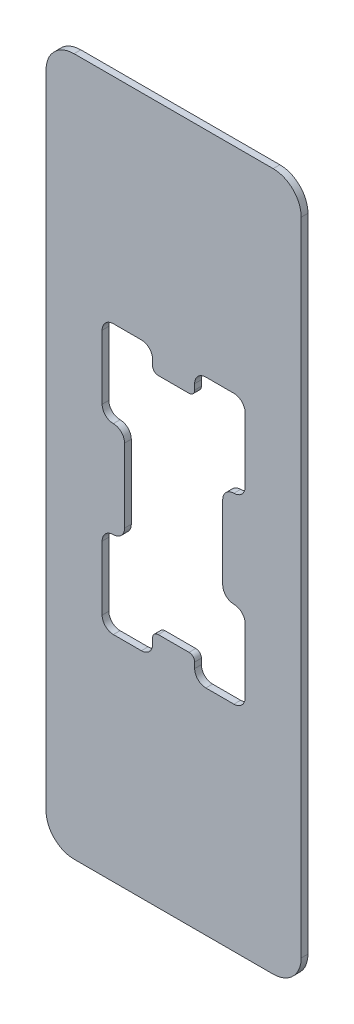
from build123d import *

# Parameters (mm, degrees)
SKETCH1_W           = 45.5
SKETCH1_H           = 124.4
BOSS_EXTRUDE1_DEPTH = 1.2
SKETCH2_W           = 5
SKETCH2_H           = 11.428571429
CUT_EXTRUDE1_DEPTH  = 1.6
FILLET1_R           = 2
FILLET2_R           = 1
FILLET3_R           = 5


with BuildPart() as part:
    # Sketch1 → Boss-Extrude1 (new body)
    with BuildSketch(Plane.XY):
        with Locations((22.75, 62.2)):
            Rectangle(SKETCH1_W, SKETCH1_H)
    extrude(amount=BOSS_EXTRUDE1_DEPTH)

    # Sketch2 → Cut-Extrude1 (cut)
    with BuildSketch(Plane.XY.offset(1.2)):
        Polygon((14, 82.2), (19, 82.2), (19, 86.2), (10, 86.2), (10, 70.771428571), (14, 70.771428571), align=None)
        with Locations((16.5, 76.485714285)):
            Rectangle(SKETCH2_W, SKETCH2_H)
        Polygon((26.5, 70.771428571), (26.5, 82.2), (19, 82.2), (19, 70.771428571), (14, 70.771428571), (14, 53.628571429), (19, 53.628571429), (19, 42.2), (26.5, 42.2), (26.5, 53.628571429), (31.5, 53.628571429), (31.5, 70.771428571), align=None)
        with Locations((29, 76.485714285)):
            Rectangle(SKETCH2_W, SKETCH2_H)
        Polygon((35.5, 70.771428571), (35.5, 86.2), (26.5, 86.2), (26.5, 82.2), (31.5, 82.2), (31.5, 70.771428571), align=None)
        Polygon((35.5, 53.628571429), (31.5, 53.628571429), (31.5, 42.2), (26.5, 42.2), (26.5, 38.2), (35.5, 38.2), align=None)
        with Locations((29, 47.914285715)):
            Rectangle(SKETCH2_W, SKETCH2_H)
        Polygon((14, 42.2), (14, 53.628571429), (10, 53.628571429), (10, 38.2), (19, 38.2), (19, 42.2), align=None)
        with Locations((16.5, 47.914285715)):
            Rectangle(SKETCH2_W, SKETCH2_H)
    extrude(amount=-CUT_EXTRUDE1_DEPTH, mode=Mode.SUBTRACT)

    # Fillet1
    fillet1_edges = [part.edges().sort_by_distance(p)[0] for p in [
        (10, 70.771428571, 0.6),
        (19, 86.2, 0.6),
        (26.5, 86.2, 0.6),
        (35.5, 86.2, 0.6),
        (35.5, 70.771428571, 0.6),
        (31.5, 70.771428571, 0.6),
        (31.5, 53.628571429, 0.6),
        (35.5, 53.628571429, 0.6),
        (35.5, 38.2, 0.6),
        (26.5, 38.2, 0.6),
        (19, 38.2, 0.6),
        (10, 38.2, 0.6),
        (10, 53.628571429, 0.6),
        (14, 53.628571429, 0.6),
        (14, 70.771428571, 0.6),
        (10, 86.2, 0.6),
    ]]
    fillet(fillet1_edges, radius=FILLET1_R - 0.0001)  # a hair under: the kernel refuses the full size

    # Fillet2
    fillet2_edges = [part.edges().sort_by_distance(p)[0] for p in [
        (19, 42.2, 0.6),
        (19, 82.2, 0.6),
        (26.5, 82.2, 0.6),
        (26.5, 42.2, 0.6),
    ]]
    fillet(fillet2_edges, radius=FILLET2_R)

    # Fillet3
    fillet3_edges = [part.edges().sort_by_distance(p)[0] for p in [
        (0, 124.4, 0.6),
        (45.5, 124.4, 0.6),
        (45.5, 0, 0.6),
        (0, 0, 0.6),
    ]]
    fillet(fillet3_edges, radius=FILLET3_R)


solid = part.part
